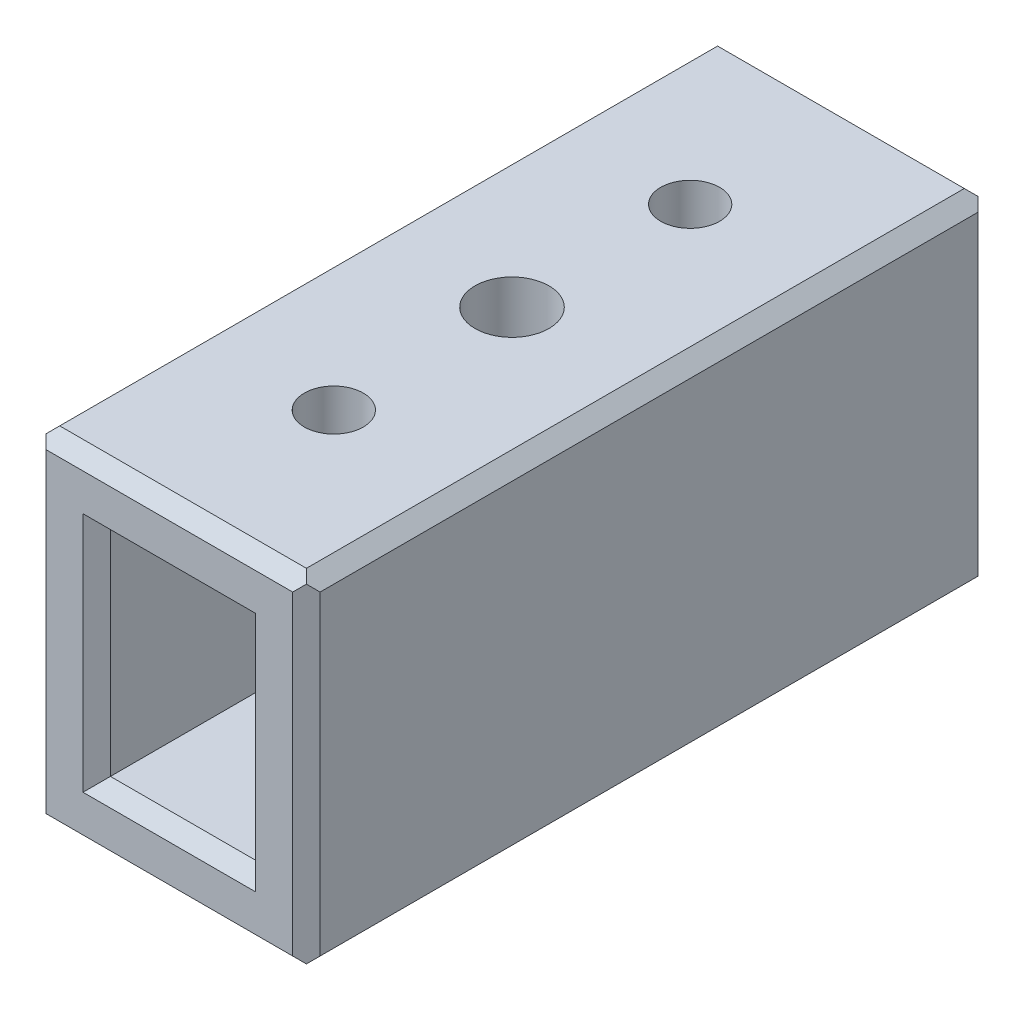
from build123d import *

# Parameters (mm, degrees)
SKETCH_2_W          = 20
SKETCH_2_H          = 25
SKETCH_2_W_2        = 10.6
SKETCH_2_H_2        = 15.6
EXTRUDE_1_DEPTH     = 50
SKETCH_3_R          = 2.15
SKETCH_3_R_2        = 2.7
CUT_EXTRUDE_2_DEPTH = 57.789083458
CHAMFER_1_SIZE      = 1
CHAMFER_2_SIZE      = 1


with BuildPart() as part:
    # 草图2 → 凸台-拉伸1 (new body)
    with BuildSketch(Plane.XY):
        Rectangle(SKETCH_2_W, SKETCH_2_H)
        Rectangle(SKETCH_2_W_2, SKETCH_2_H_2, mode=Mode.SUBTRACT)
    extrude(amount=-EXTRUDE_1_DEPTH)

    # 草图3 → 切除-拉伸2 (cut, through all)
    with BuildSketch(Plane(origin=(0, 12.5, 0), x_dir=(1, 0, 0), z_dir=(0, 1, 0))):
        with Locations((0, 38)):
            Circle(SKETCH_3_R)
        with Locations((0, 12)):
            Circle(SKETCH_3_R)
        with Locations((0, 25)):
            Circle(SKETCH_3_R_2)
    extrude(amount=-CUT_EXTRUDE_2_DEPTH, mode=Mode.SUBTRACT)

    # 倒角1
    chamfer_1_edges = [part.edges().sort_by_distance(p)[0] for p in [
        (0, 12.5, -50),
        (-10, 0, -50),
        (0, -12.5, -50),
        (10, 0, -50),
        (5.3, 0, -50),
        (0, -7.8, -50),
        (-5.3, 0, -50),
        (0, 7.8, -50),
        (0, -12.5, 0),
        (-10, 0, 0),
        (0, 12.5, 0),
        (10, 0, 0),
        (0, -7.8, 0),
        (5.3, 0, 0),
        (0, 7.8, 0),
        (-5.3, 0, 0),
    ]]
    chamfer(chamfer_1_edges, length=CHAMFER_1_SIZE)

    # 倒角2
    chamfer_2_edges = [part.edges().sort_by_distance(p)[0] for p in [
        (10, -12.5, -25),
        (-10, -12.5, -25),
        (10, 12.5, -25),
        (-10, 12.5, -25),
    ]]
    chamfer(chamfer_2_edges, length=CHAMFER_2_SIZE)


solid = part.part
